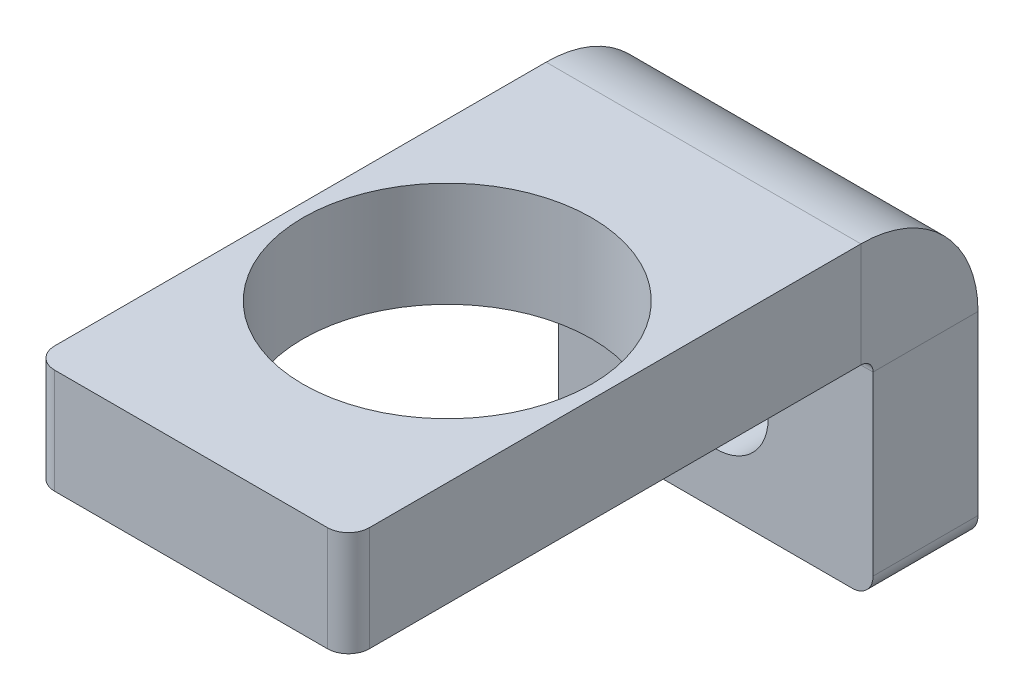
from build123d import *

# Parameters (mm, degrees)
BASE_FLANGE1_START           = -6.35
BASE_FLANGE1_OUTLINE_W       = 19.05
BASE_FLANGE1_OUTLINE_H       = 19.05
BASE_FLANGE1_OUTLINE_R       = 3.175
BASE_FLANGE1_DEPTH           = 6.35
EDGE_FLANGE1_STRIP_W         = 26.8732
EDGE_FLANGE1_STRIP_H         = 6.35
EDGE_FLANGE1_STRIP_CUT_DEPTH = 19.05
EDGE_FLANGE1_DEPTH           = 19.05
SKETCH9_R                    = 8.73125
CUT_EXTRUDE1_DEPTH           = 36.497579143
FILLET2_R                    = 1.27


# Read off the part's stored shape, not the designer's step: Base-Flange1
# Sheet-metal steps are written as plain solids
with BuildPart() as part:
    # Base-Flange1 outline → Base-Flange1 (new body)
    with BuildSketch(Plane.XY.offset(BASE_FLANGE1_START)):
        Rectangle(BASE_FLANGE1_OUTLINE_W, BASE_FLANGE1_OUTLINE_H)
        with Locations((0, -3.175)):
            Circle(BASE_FLANGE1_OUTLINE_R, mode=Mode.SUBTRACT)
    extrude(amount=BASE_FLANGE1_DEPTH)

    # Edge-Flange1 strip (across the edge) → Edge-Flange1 strip cut (cut)
    with BuildSketch(Plane(origin=(9.525, 9.525, 0), x_dir=(0, -1, 0), z_dir=(-1, 0, 0))):
        with Locations((-6.35, -3.175)):
            Rectangle(EDGE_FLANGE1_STRIP_W, EDGE_FLANGE1_STRIP_H)
    extrude(amount=EDGE_FLANGE1_STRIP_CUT_DEPTH, mode=Mode.SUBTRACT)

    # Edge-Flange1 section (across the edge) → Edge-Flange1 (add)
    with BuildSketch(Plane(origin=(9.525, 9.525, 0), x_dir=(0, -1, 0), z_dir=(-1, 0, 0))):
        with BuildLine():
            Line((0, 0.7366), (0, 31.75))
            Line((0, 31.75), (6.35, 31.75))
            Line((6.35, 31.75), (6.35, 0.7366))
            ThreePointArc((6.35, 0.7366), (6.565745145, 0.215745145), (7.0866, 0))
            Line((7.0866, 0), (7.0866, -6.35))
            ThreePointArc((7.0866, -6.35), (2.075617084, -4.274382916), (0, 0.7366))
        make_face()
    extrude(amount=EDGE_FLANGE1_DEPTH)

    # Sketch9 → Cut-Extrude1 (cut, through all)
    with BuildSketch(Plane.XZ.offset(-3.175)):
        with Locations(Location((0, 16.2433, 0), (0, 0, 270))):
            Circle(SKETCH9_R)
    extrude(amount=-CUT_EXTRUDE1_DEPTH, mode=Mode.SUBTRACT)

    # Fillet2
    fillet2_edges = [part.edges().sort_by_distance(p)[0] for p in [
        (9.525, 6.35, 31.75),
        (-9.525, 6.35, 31.75),
        (9.525, -9.525, -3.175),
        (-9.525, -9.525, -3.175),
    ]]
    fillet(fillet2_edges, radius=FILLET2_R)


solid = part.part
